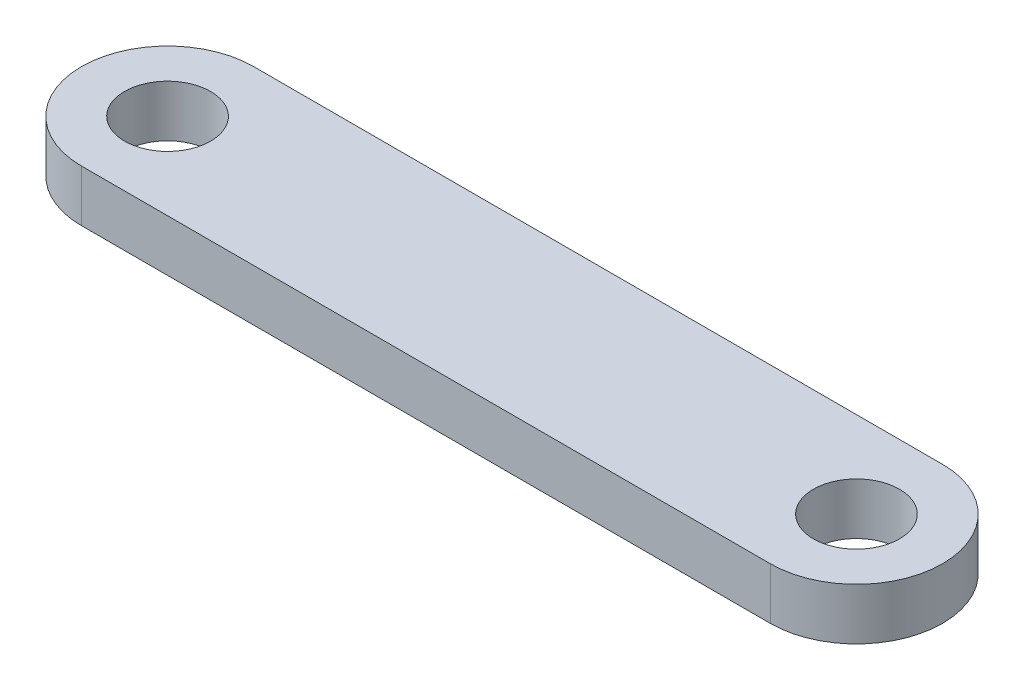
from build123d import *

# Parameters (mm, degrees)
SKETCH1_R           = 3.175
BOSS_EXTRUDE1_DEPTH = 3.81


with BuildPart() as part:
    # Sketch1 → Boss-Extrude1 (new body)
    with BuildSketch(Plane(origin=(0, 0, 0), x_dir=(1, 0, 0), z_dir=(0, 1, 0))):
        with BuildLine():
            Line((-25.4, 6.35), (25.4, 6.35))
            ThreePointArc((25.4, 6.35), (31.75, 0), (25.4, -6.35))
            Line((25.4, -6.35), (-25.4, -6.35))
            ThreePointArc((-25.4, -6.35), (-31.75, 0), (-25.4, 6.35))
        make_face()
        with Locations((-25.4, 0)):
            Circle(SKETCH1_R, mode=Mode.SUBTRACT)
        with Locations((25.4, 0)):
            Circle(SKETCH1_R, mode=Mode.SUBTRACT)
    extrude(amount=BOSS_EXTRUDE1_DEPTH)


solid = part.part
